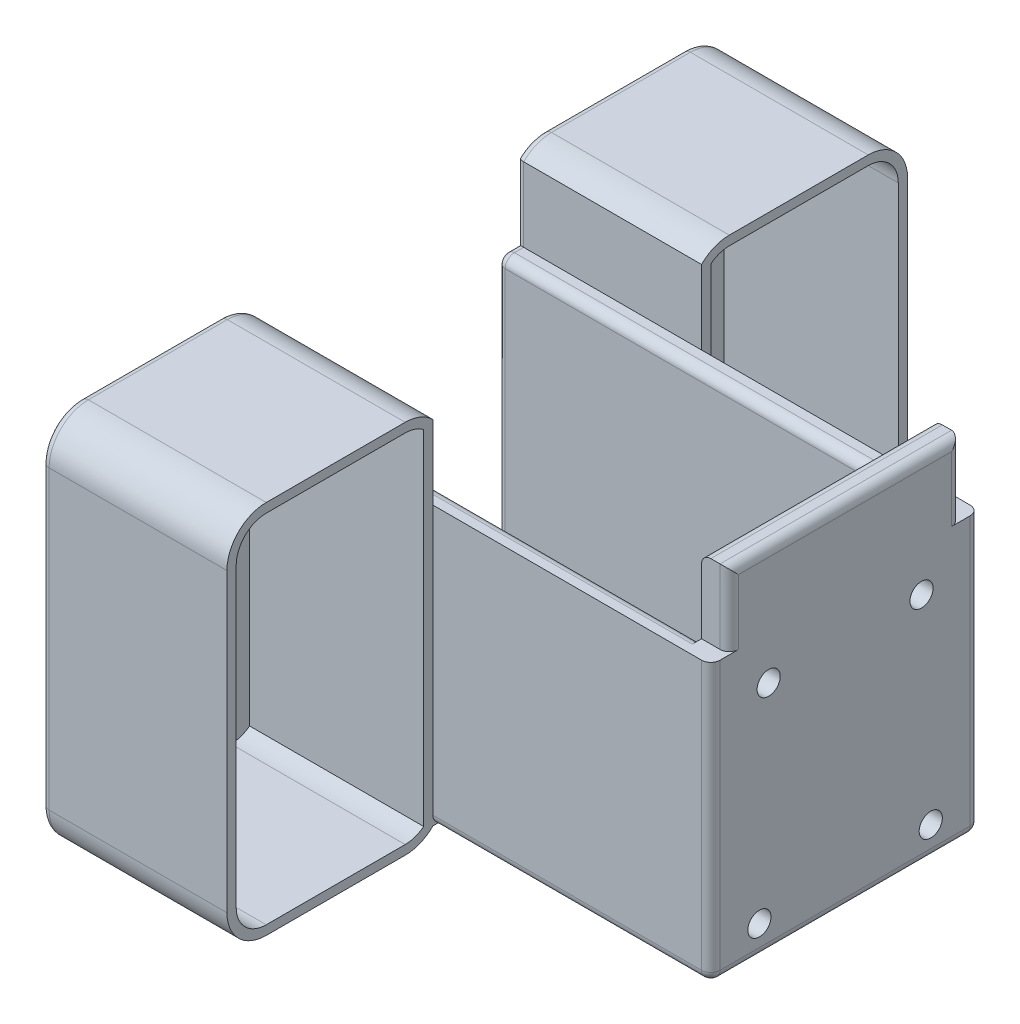
from build123d import *

# Parameters (mm, degrees)
SKETCH_1_W      = 25
SKETCH_1_H      = 38
SKETCH_1_R      = 1.25
EXTRUDE_2_DEPTH = 3
SKETCH_2_W      = 2
SKETCH_2_H      = 30
EXTRUDE_3_DEPTH = 50
EXTRUDE_6_DEPTH = 20
EXTRUDE_7_DEPTH = 1.2
FILLET_4_R      = 1
FILLET_5_R      = 0.8


with BuildPart() as part:
    # 草图1 → 凸台-拉伸2 (new body)
    with BuildSketch(Plane(origin=(0, 0, 0), x_dir=(0, 0, -1), z_dir=(1, 0, 0))):
        Rectangle(SKETCH_1_W, SKETCH_1_H)
        with Locations((9.25, -15.75)):
            Circle(SKETCH_1_R, mode=Mode.SUBTRACT)
        with Locations((8.25, 6.25)):
            Circle(SKETCH_1_R, mode=Mode.SUBTRACT)
        with Locations(Location((-9.25, -15.75, 0), (0, 0, 180))):
            Circle(SKETCH_1_R, mode=Mode.SUBTRACT)
        with Locations(Location((-8.25, 6.25, 0), (0, 0, 180))):
            Circle(SKETCH_1_R, mode=Mode.SUBTRACT)
    extrude(amount=EXTRUDE_2_DEPTH)

    # 草图2 → 凸台-拉伸3 (add)
    with BuildSketch(Plane(origin=(3, 0, 0), x_dir=(0, 0, -1), z_dir=(1, 0, 0))):
        with Locations((13.5, -4)):
            Rectangle(SKETCH_2_W, SKETCH_2_H)
        with Locations((-13.5, -4)):
            Rectangle(SKETCH_2_W, SKETCH_2_H)
    extrude(amount=-EXTRUDE_3_DEPTH)

    # 草图4 → 凸台-拉伸6 (add)
    # profile 1 of 2: a face of its own
    with BuildSketch(Plane.ZY.offset(47)):
        with BuildLine():
            Line((-14.5, 11), (-14.5, 19))
            ThreePointArc((-14.5, 19), (-15.8764117, 19.919688895), (-17.5, 20.242640687))
            Line((-17.5, 20.242640687), (-32.5, 20.242640687))
            ThreePointArc((-32.5, 20.242640687), (-35.5, 19), (-36.742640687, 16))
            Line((-36.742640687, 16), (-36.742640687, -16))
            ThreePointArc((-36.742640687, -16), (-35.5, -19), (-32.5, -20.242640687))
            Line((-32.5, -20.242640687), (-17.5, -20.242640687))
            ThreePointArc((-17.5, -20.242640687), (-15.8764117, -19.919688895), (-14.5, -19))
            Line((-14.5, -19), (-14.5, 11))
        make_face()
        with BuildLine():
            Line((-32.5, 19.242640687), (-25, 19.242640687))
            Line((-25, 19.242640687), (-17.5, 19.242640687))
            ThreePointArc((-17.5, 19.242640687), (-16.442120098, 19.065225724), (-15.5, 18.552394685))
            Line((-15.5, 18.552394685), (-15.5, -12.035462258))
            Line((-15.5, -12.035462258), (-15.5, -18.552394685))
            ThreePointArc((-15.5, -18.552394685), (-16.442120098, -19.065225724), (-17.5, -19.242640687))
            Line((-17.5, -19.242640687), (-31.503062925, -19.242640687))
            Line((-31.503062925, -19.242640687), (-32.5, -19.242640687))
            ThreePointArc((-32.5, -19.242640687), (-34.792893219, -18.292893219), (-35.742640687, -16))
            Line((-35.742640687, -16), (-35.742640687, -12.035462258))
            Line((-35.742640687, -12.035462258), (-35.742640687, 16))
            ThreePointArc((-35.742640687, 16), (-34.792893219, 18.292893219), (-32.5, 19.242640687))
        make_face(mode=Mode.SUBTRACT)
    # profile 2 of 2: a face of its own
    with BuildSketch(Plane.ZY.offset(47)):
        with BuildLine():
            Line((14.5, -19), (14.5, 11))
            Line((14.5, 11), (14.5, 19))
            ThreePointArc((14.5, 19), (15.8764117, 19.919688895), (17.5, 20.242640687))
            Line((17.5, 20.242640687), (32.5, 20.242640687))
            ThreePointArc((32.5, 20.242640687), (35.5, 19), (36.742640687, 16))
            Line((36.742640687, 16), (36.742640687, -16))
            ThreePointArc((36.742640687, -16), (35.5, -19), (32.5, -20.242640687))
            Line((32.5, -20.242640687), (17.5, -20.242640687))
            ThreePointArc((17.5, -20.242640687), (15.8764117, -19.919688895), (14.5, -19))
        make_face()
        with BuildLine():
            Line((35.742640687, -12.035462258), (35.742640687, 16))
            ThreePointArc((35.742640687, 16), (34.792893219, 18.292893219), (32.5, 19.242640687))
            Line((32.5, 19.242640687), (25, 19.242640687))
            Line((25, 19.242640687), (17.5, 19.242640687))
            ThreePointArc((17.5, 19.242640687), (16.442120098, 19.065225724), (15.5, 18.552394685))
            Line((15.5, 18.552394685), (15.5, -12.035462258))
            Line((15.5, -12.035462258), (15.5, -18.552394685))
            ThreePointArc((15.5, -18.552394685), (16.442120098, -19.065225724), (17.5, -19.242640687))
            Line((17.5, -19.242640687), (31.503062925, -19.242640687))
            Line((31.503062925, -19.242640687), (32.5, -19.242640687))
            ThreePointArc((32.5, -19.242640687), (34.792893219, -18.292893219), (35.742640687, -16))
            Line((35.742640687, -16), (35.742640687, -12.035462258))
        make_face(mode=Mode.SUBTRACT)
    extrude(amount=-EXTRUDE_6_DEPTH)

    # 草图5 → 凸台-拉伸7 (add)
    with BuildSketch(Plane.ZY.offset(47)):
        with BuildLine():
            Line((-32.5, 19.242640687), (-17.5, 19.242640687))
            ThreePointArc((-17.5, 19.242640687), (-16.442120098, 19.065225724), (-15.5, 18.552394685))
            Line((-15.5, 18.552394685), (-15.5, -18.552394685))
            ThreePointArc((-15.5, -18.552394685), (-16.442120098, -19.065225724), (-17.5, -19.242640687))
            Line((-17.5, -19.242640687), (-32.5, -19.242640687))
            ThreePointArc((-32.5, -19.242640687), (-34.792893219, -18.292893219), (-35.742640687, -16))
            Line((-35.742640687, -16), (-35.742640687, 16))
            ThreePointArc((-35.742640687, 16), (-34.792893219, 18.292893219), (-32.5, 19.242640687))
        make_face()
        with BuildLine():
            Line((35.742640687, -16), (35.742640687, 16))
            ThreePointArc((35.742640687, 16), (34.792893219, 18.292893219), (32.5, 19.242640687))
            Line((32.5, 19.242640687), (17.5, 19.242640687))
            ThreePointArc((17.5, 19.242640687), (16.442120098, 19.065225724), (15.5, 18.552394685))
            Line((15.5, 18.552394685), (15.5, -18.552394685))
            ThreePointArc((15.5, -18.552394685), (16.442120098, -19.065225724), (17.5, -19.242640687))
            Line((17.5, -19.242640687), (32.5, -19.242640687))
            ThreePointArc((32.5, -19.242640687), (34.792893219, -18.292893219), (35.742640687, -16))
        make_face()
    extrude(amount=-EXTRUDE_7_DEPTH)

    # 圆角4
    fillet_4_edges = [part.edges().sort_by_distance(p)[0] for p in [
        (-23.5, -19, 12.5),
        (-12, -19, 14.5),
        (-12, -19, -14.5),
        (0, -19, 0),
        (0, 19, 0),
        (-23.5, 11, -12.5),
        (-23.5, 11, 12.5),
        (3, -19, 0),
        (3, 15, 12.5),
        (3, -4, 14.5),
        (3, -4, -14.5),
        (3, 15, -12.5),
        (3, 19, 0),
    ]]
    fillet(fillet_4_edges, radius=FILLET_4_R - 0.0001)  # a hair under: the kernel refuses the full size

    # 圆角5
    fillet_5_edges = [part.edges().sort_by_distance(p)[0] for p in [
        (-47, -19.919688895, 15.8764117),
        (-47, -20.242640687, 25),
        (-47, -19, 35.5),
        (-47, 0, 36.742640687),
        (-47, 19, 35.5),
        (-47, 20.242640687, 25),
        (-47, 19.919688895, 15.8764117),
        (-47, 15, 14.5),
        (-47, -4, 12.5),
        (-47, 11, 13.99995),
        (-47, 10.707136071, 12.792863929),
        (-47, -18.707136071, 12.792863929),
        (-47, -4.49995, -12.5),
        (-47, 10.707136071, -12.792863929),
        (-47, 11, -13.99995),
        (-47, -19, -13.5),
        (-47, -19, 13.99995),
        (-47, 19.919688895, -15.8764117),
        (-47, 20.242640687, -25),
        (-47, 19, -35.5),
        (-47, 0, -36.742640687),
        (-47, -19, -35.5),
        (-47, -20.242640687, -25),
        (-47, -19.919688895, -15.8764117),
        (-47, 15, -14.5),
    ]]
    fillet(fillet_5_edges, radius=FILLET_5_R)


solid = part.part
